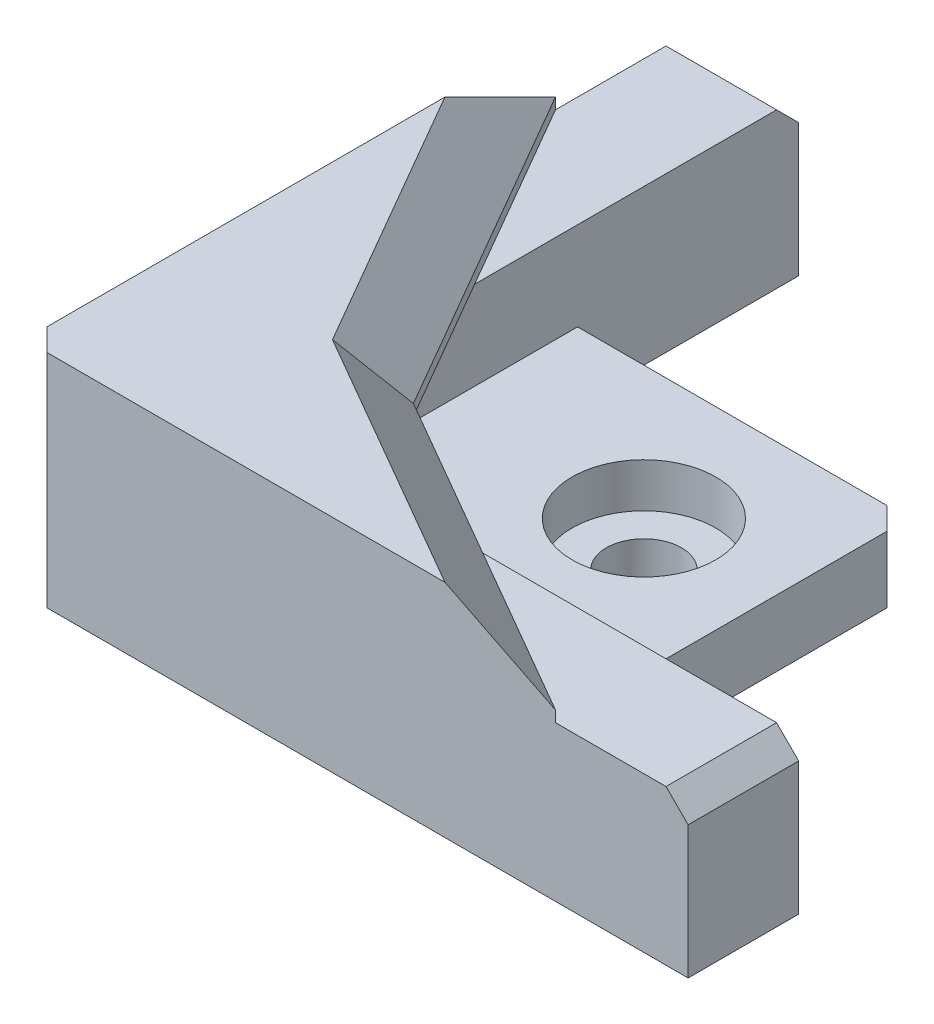
from build123d import *

# Parameters (mm, degrees)
BOSS_EXTRUDE1_DEPTH                                  = 3
BOSS_EXTRUDE2_DEPTH                                  = 4
REFRENTADO_PARA_TORNILLO_CON_CABEZA_PLAN_D           = 3.4
REFRENTADO_PARA_TORNILLO_CON_CABEZA_PLAN_DEPTH       = 40
REFRENTADO_PARA_TORNILLO_CON_CABEZA_PLAN_CBORE_D     = 6.5
REFRENTADO_PARA_TORNILLO_CON_CABEZA_PLAN_CBORE_DEPTH = 2
REFRENTADO_PARA_TORNILLO_CON_CABEZA_PLAN_TIP         = 1.021463052
BOSS_EXTRUDE3_START                                  = 2.5
SKETCH5_R                                            = 3
SKETCH5_R_2                                          = 1.7
BOSS_EXTRUDE3_DEPTH                                  = 2.5
BOSS_EXTRUDE4_DEPTH                                  = 3
CHAMFER1_SIZE                                        = 2.5
CHAMFER2_SIZE                                        = 1
FILLET2_R                                            = 1


with BuildPart() as part:
    # Sketch1 → Boss-Extrude1 (new body)
    with BuildSketch(Plane(origin=(0, 0, 0), x_dir=(1, 0, 0), z_dir=(0, 1, 0))):
        Polygon((0, 15), (0, 25), (-5, 25), (-5, -5), (25, -5), (25, 0), (15, 0), (15, 15), align=None)
    extrude(amount=BOSS_EXTRUDE1_DEPTH)

    # Sketch2 → Boss-Extrude2 (add)
    with BuildSketch(Plane(origin=(0, 3, 0), x_dir=(1, 0, 0), z_dir=(0, 1, 0))):
        Polygon((-5, 25), (0, 25), (0, 0), (25, 0), (25, -5), (-5, -5), align=None)
    extrude(amount=BOSS_EXTRUDE2_DEPTH)

    # Refrentado para tornillo con cabeza plana de M31
    with Locations(Plane(origin=(0, 3, 0), x_dir=(1, 0, 0), z_dir=(0, 1, 0))):
        with Locations((9, 9)):
            CounterBoreHole(REFRENTADO_PARA_TORNILLO_CON_CABEZA_PLAN_D / 2, REFRENTADO_PARA_TORNILLO_CON_CABEZA_PLAN_CBORE_D / 2, REFRENTADO_PARA_TORNILLO_CON_CABEZA_PLAN_CBORE_DEPTH, depth=REFRENTADO_PARA_TORNILLO_CON_CABEZA_PLAN_DEPTH)
            with Locations((0, 0, -(REFRENTADO_PARA_TORNILLO_CON_CABEZA_PLAN_DEPTH + REFRENTADO_PARA_TORNILLO_CON_CABEZA_PLAN_TIP / 2))):  # 118° drill point
                Cone(0, REFRENTADO_PARA_TORNILLO_CON_CABEZA_PLAN_D / 2, REFRENTADO_PARA_TORNILLO_CON_CABEZA_PLAN_TIP, mode=Mode.SUBTRACT)

    # Sketch5 → Boss-Extrude3 (add)
    with BuildSketch(Plane.XZ.offset(BOSS_EXTRUDE3_START)):
        with Locations((9, -9)):
            Circle(SKETCH5_R)
        with Locations((9, -9)):
            Circle(SKETCH5_R_2, mode=Mode.SUBTRACT)
    extrude(amount=-BOSS_EXTRUDE3_DEPTH)

    # Sketch6 → Boss-Extrude4 (add)
    with BuildSketch(Plane(origin=(0, 7, 0), x_dir=(1, 0, 0), z_dir=(0, 1, 0))):
        Polygon((-5, -5), (-5, 19), (3.788160363, 3.788160363), (19, -5), align=None)
    extrude(amount=BOSS_EXTRUDE4_DEPTH)

    # Chamfer1
    chamfer1_edges = [part.edges().sort_by_distance(p)[0] for p in [
        (11.394080181, 10, 0.605919819),
        (-0.605919819, 10, -11.394080181),
    ]]
    chamfer(chamfer1_edges, length=CHAMFER1_SIZE)

    # Chamfer2
    chamfer2_edges = [part.edges().sort_by_distance(p)[0] for p in [
        (-5, 5, 5),
        (15, 1.5, -15),
        (-2.5, 7, -25),
        (25, 7, 2.5),
    ]]
    chamfer(chamfer2_edges, length=CHAMFER2_SIZE)

    # Fillet2
    fillet2_edges = [part.edges().sort_by_distance(p)[0] for p in [
        (6, 0, -9),
    ]]
    fillet(fillet2_edges, radius=FILLET2_R)


solid = part.part
